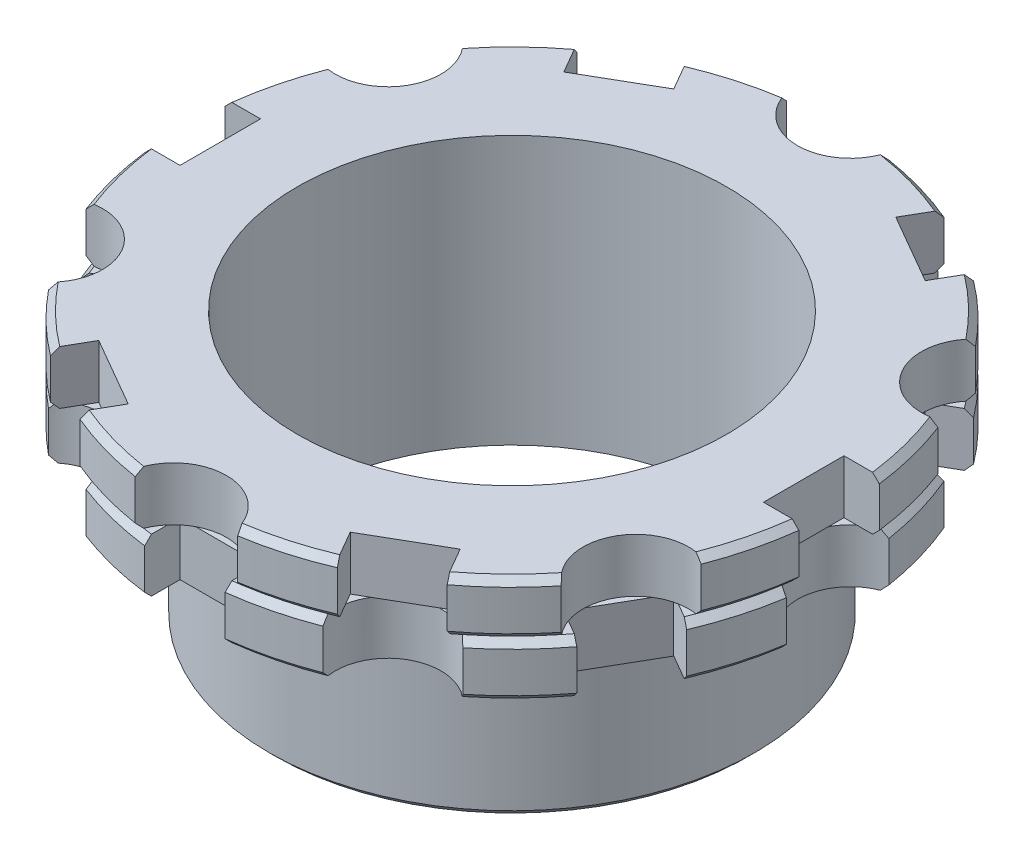
from build123d import *

# Parameters (mm, degrees)
SKETCH2_R          = 3.94
SKETCH2_W          = 7
SKETCH2_H          = 6
CUT_EXTRUDE1_DEPTH = 4
SKETCH3_R          = 3.94
SKETCH3_W          = 6
SKETCH3_H          = 7
CUT_EXTRUDE2_DEPTH = 4


with BuildPart() as part:
    # Sketch1 → Revolve1 (revolve)
    with BuildSketch(Plane(origin=(0, 0, 0), x_dir=(0, 0, -1), z_dir=(1, 0, 0))):
        with BuildLine():
            Line((16, -67), (17.6, -67))
            Line((17.6, -67), (18.1, -66.5))
            Line((18.1, -66.5), (18.1, -55.4))
            ThreePointArc((18.1, -55.4), (18.217157288, -55.117157288), (18.5, -55))
            Line((18.5, -55), (24.07, -55))
            Line((24.07, -55), (24.57, -54.5))
            Line((24.57, -54.5), (24.57, -51.5))
            Line((24.57, -51.5), (24.07, -51))
            Line((24.07, -51), (24.57, -50.5))
            Line((24.57, -50.5), (24.57, -47.5))
            Line((24.57, -47.5), (24.07, -47))
            Line((24.07, -47), (16, -47))
            Line((16, -47), (16, -67))
        make_face()
    revolve(axis=Axis((0, 0, 0), (0, -1, 0)))

    # Sketch2 → Cut-Extrude1 (cut)
    with BuildSketch(Plane(origin=(0, -47, 0), x_dir=(1, 0, 0), z_dir=(0, 1, 0))):
        with Locations((0, 25.23)):
            Circle(SKETCH2_R)
        with Locations((21.849820937, 12.615)):
            Circle(SKETCH2_R)
        with Locations((21.849820937, -12.615)):
            Circle(SKETCH2_R)
        with Locations((0, -25.23)):
            Circle(SKETCH2_R)
        with Locations((-21.849820937, -12.615)):
            Circle(SKETCH2_R)
        with Locations((-21.849820937, 12.615)):
            Circle(SKETCH2_R)
        Polygon((11.776923789, 26.398230359), (8.276923789, 20.336052532), (13.473076211, 17.336052532), (16.973076211, 23.398230359), align=None)
        with Locations((25.25, 0)):
            Rectangle(SKETCH2_W, SKETCH2_H)
        Polygon((16.973076211, -23.398230359), (13.473076211, -17.336052532), (8.276923789, -20.336052532), (11.776923789, -26.398230359), align=None)
        Polygon((-11.776923789, -26.398230359), (-8.276923789, -20.336052532), (-13.473076211, -17.336052532), (-16.973076211, -23.398230359), align=None)
        with Locations((-25.25, 0)):
            Rectangle(SKETCH2_W, SKETCH2_H)
        Polygon((-16.973076211, 23.398230359), (-13.473076211, 17.336052532), (-8.276923789, 20.336052532), (-11.776923789, 26.398230359), align=None)
    extrude(amount=-CUT_EXTRUDE1_DEPTH, mode=Mode.SUBTRACT)

    # Sketch3 → Cut-Extrude2 (cut)
    with BuildSketch(Plane(origin=(0, -51, 0), x_dir=(1, 0, 0), z_dir=(0, 1, 0))):
        with Locations((12.615, 21.849820937)):
            Circle(SKETCH3_R)
        with Locations((25.23, 0)):
            Circle(SKETCH3_R)
        with Locations((12.615, -21.849820937)):
            Circle(SKETCH3_R)
        with Locations((-12.615, -21.849820937)):
            Circle(SKETCH3_R)
        with Locations((-25.23, 0)):
            Circle(SKETCH3_R)
        with Locations((-12.615, 21.849820937)):
            Circle(SKETCH3_R)
        with Locations((0, 25.25)):
            Rectangle(SKETCH3_W, SKETCH3_H)
        Polygon((23.398230359, 16.973076211), (17.336052532, 13.473076211), (20.336052532, 8.276923789), (26.398230359, 11.776923789), align=None)
        Polygon((26.398230359, -11.776923789), (20.336052532, -8.276923789), (17.336052532, -13.473076211), (23.398230359, -16.973076211), align=None)
        with Locations((0, -25.25)):
            Rectangle(SKETCH3_W, SKETCH3_H)
        Polygon((-23.398230359, -16.973076211), (-17.336052532, -13.473076211), (-20.336052532, -8.276923789), (-26.398230359, -11.776923789), align=None)
        Polygon((-26.398230359, 11.776923789), (-20.336052532, 8.276923789), (-17.336052532, 13.473076211), (-23.398230359, 16.973076211), align=None)
    extrude(amount=-CUT_EXTRUDE2_DEPTH, mode=Mode.SUBTRACT)


solid = part.part
